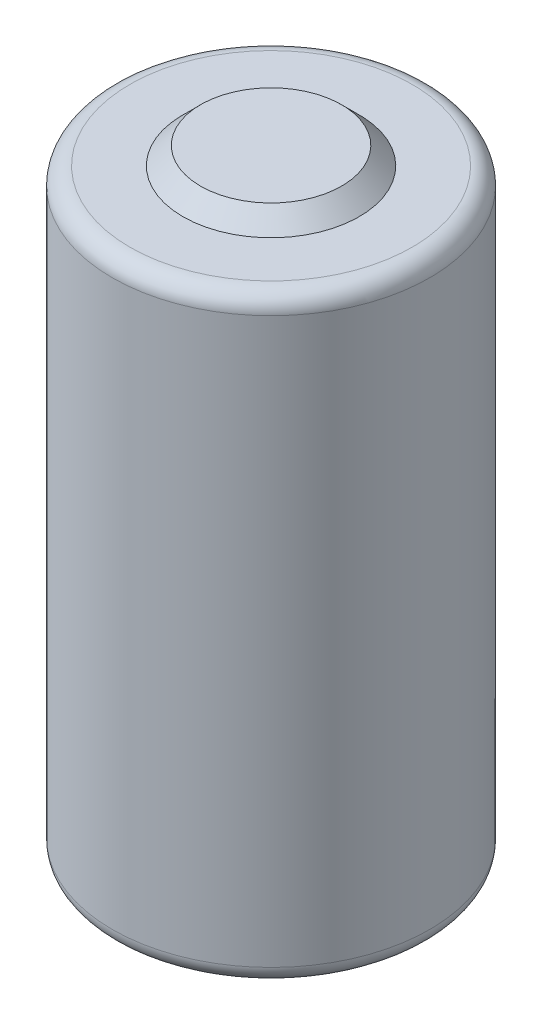
from build123d import *

# Parameters (mm, degrees)
SKETCH1_R           = 9
BOSS_EXTRUDE1_DEPTH = 34
SKETCH2_R           = 4
BOSS_EXTRUDE2_DEPTH = 1
FILLET1_R           = 1
CHAMFER1_SIZE       = 1


with BuildPart() as part:
    # Sketch1 → Boss-Extrude1 (new body)
    with BuildSketch(Plane(origin=(0, 0, 0), x_dir=(1, 0, 0), z_dir=(0, 1, 0))):
        with Locations(Location((0, 0, 0), (0, 0, 270))):
            Circle(SKETCH1_R)
    extrude(amount=BOSS_EXTRUDE1_DEPTH)

    # Sketch2 → Boss-Extrude2 (add)
    with BuildSketch(Plane(origin=(0, 34, 0), x_dir=(1, 0, 0), z_dir=(0, 1, 0))):
        with Locations(Location((0, 0, 0), (0, 0, 270))):
            Circle(SKETCH2_R)
    extrude(amount=BOSS_EXTRUDE2_DEPTH)

    # Fillet1
    fillet1_edges = [part.edges().sort_by_distance(p)[0] for p in [
        (0, 0, -9),
        (0, 34, -9),
    ]]
    fillet(fillet1_edges, radius=FILLET1_R)

    # Chamfer1
    chamfer1_edges = [part.edges().sort_by_distance(p)[0] for p in [
        (0, 34, -4),
    ]]
    chamfer(chamfer1_edges, length=CHAMFER1_SIZE - 0.0001)  # a hair under: the kernel refuses the full size


solid = part.part
